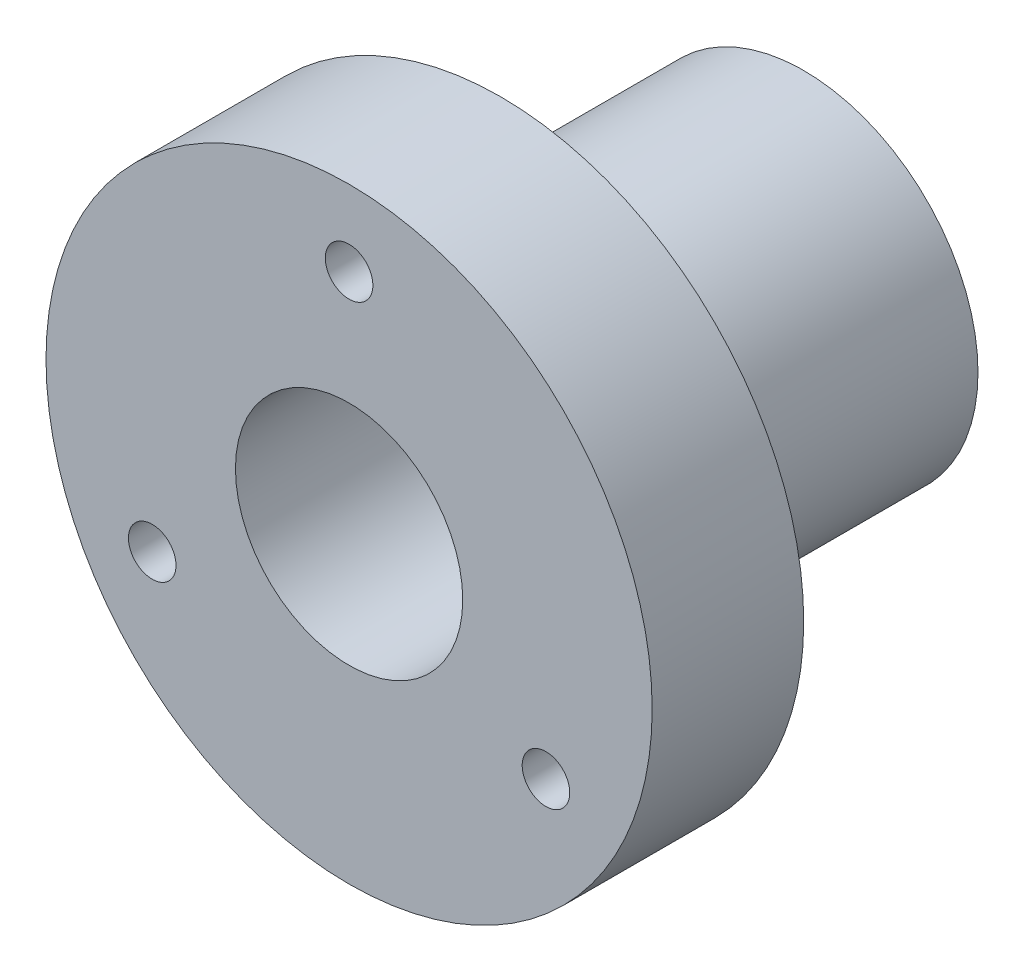
from build123d import *

# Parameters (mm, degrees)
SKETCH1_R                       = 25.4
BOSS_EXTRUDE1_DEPTH             = 12.7
SKETCH9_R                       = 14.605
BOSS_EXTRUDE2_DEPTH             = 38.1
F_10_24_TAPPED_HOLE1_D          = 3.9878
F_8_4_8_4_DIAMETER_HOLE2_D      = 8.4
F_10_0_10_DIAMETER_HOLE1_D      = 10
F_10_0_10_DIAMETER_HOLE1_DEPTH  = 10.16
F_10_0_10_DIAMETER_HOLE1_TIP    = 3.004303095
F_3_4_0_75_DIAMETER_HOLE1_D     = 19.05
F_3_4_0_75_DIAMETER_HOLE1_DEPTH = 22.86


with BuildPart() as part:
    # Sketch1 → Boss-Extrude1 (new body)
    with BuildSketch(Plane.XY):
        Circle(SKETCH1_R)
    extrude(amount=-BOSS_EXTRUDE1_DEPTH)

    # Sketch9 → Boss-Extrude2 (add)
    with BuildSketch(Plane.XY):
        Circle(SKETCH9_R)
    extrude(amount=-BOSS_EXTRUDE2_DEPTH)

    # #10-24 Tapped Hole1 (through all)
    with Locations(Plane(origin=(0, 0, -12.7), x_dir=(-1, 0, 0), z_dir=(0, 0, -1))):
        with Locations((0, 19.05), (-16.497783942, -9.525), (16.497783942, -9.525)):
            Hole(F_10_24_TAPPED_HOLE1_D / 2)

    # Ø8.4 (8.4) Diameter Hole2 (through all)
    with Locations(Plane(origin=(0, 0, -38.1), x_dir=(-1, 0, 0), z_dir=(0, 0, -1))):
        with Locations((0, 0)):
            Hole(F_8_4_8_4_DIAMETER_HOLE2_D / 2)

    # Ø10.0 (10) Diameter Hole1
    with Locations(Plane(origin=(0, 0, -38.1), x_dir=(-1, 0, 0), z_dir=(0, 0, -1))):
        with Locations((0, 0)):
            Hole(F_10_0_10_DIAMETER_HOLE1_D / 2, depth=F_10_0_10_DIAMETER_HOLE1_DEPTH)
            with Locations((0, 0, -(F_10_0_10_DIAMETER_HOLE1_DEPTH + F_10_0_10_DIAMETER_HOLE1_TIP / 2))):  # 118° drill point
                Cone(0, F_10_0_10_DIAMETER_HOLE1_D / 2, F_10_0_10_DIAMETER_HOLE1_TIP, mode=Mode.SUBTRACT)

    # 3/4 (0.75) Diameter Hole1
    with Locations(Plane.XY):
        with Locations((0, 0)):
            Hole(F_3_4_0_75_DIAMETER_HOLE1_D / 2, depth=F_3_4_0_75_DIAMETER_HOLE1_DEPTH)


solid = part.part
